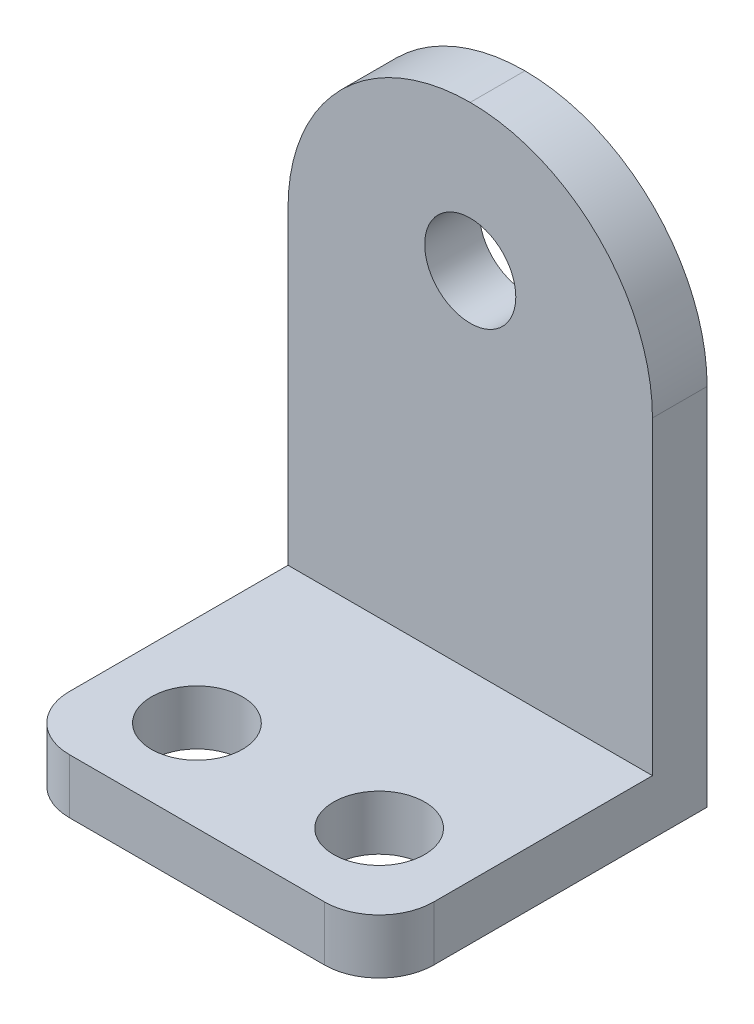
from build123d import *

# Parameters (mm, degrees)
BOSS_EXTRUDE3_DEPTH = 20
SKETCH4_R           = 2.5
CUT_EXTRUDE1_DEPTH  = 20
SKETCH5_R           = 2.5
CUT_EXTRUDE2_DEPTH  = 20
FILLET1_R           = 10
FILLET2_R           = 3


with BuildPart() as part:
    # Sketch3 → Boss-Extrude3 (new body)
    with BuildSketch(Plane(origin=(0, 0, 0), x_dir=(0, 0, -1), z_dir=(1, 0, 0))):
        Polygon((0, 0), (0, 30), (-3, 30), (-3, 3), (-18, 3), (-18, 0), align=None)
    extrude(amount=BOSS_EXTRUDE3_DEPTH)

    # Sketch4 → Cut-Extrude1 (cut)
    with BuildSketch(Plane.XY.offset(3)):
        with Locations((10, 22)):
            Circle(SKETCH4_R)
    extrude(amount=-CUT_EXTRUDE1_DEPTH, mode=Mode.SUBTRACT)

    # Sketch5 → Cut-Extrude2 (cut)
    with BuildSketch(Plane(origin=(0, 3, 0), x_dir=(1, 0, 0), z_dir=(0, 1, 0))):
        with Locations(Location((5, -13, 0), (0, 0, 270))):
            Circle(SKETCH5_R)
        with Locations(Location((15, -13, 0), (0, 0, 270))):
            Circle(SKETCH5_R)
    extrude(amount=-CUT_EXTRUDE2_DEPTH, mode=Mode.SUBTRACT)

    # Fillet1
    fillet1_edges = [part.edges().sort_by_distance(p)[0] for p in [
        (0, 30, 1.5),
        (20, 30, 1.5),
    ]]
    fillet(fillet1_edges, radius=FILLET1_R - 0.0001)  # a hair under: the kernel refuses the full size

    # Fillet2
    fillet2_edges = [part.edges().sort_by_distance(p)[0] for p in [
        (20, 1.5, 18),
        (0, 1.5, 18),
    ]]
    fillet(fillet2_edges, radius=FILLET2_R)


solid = part.part
